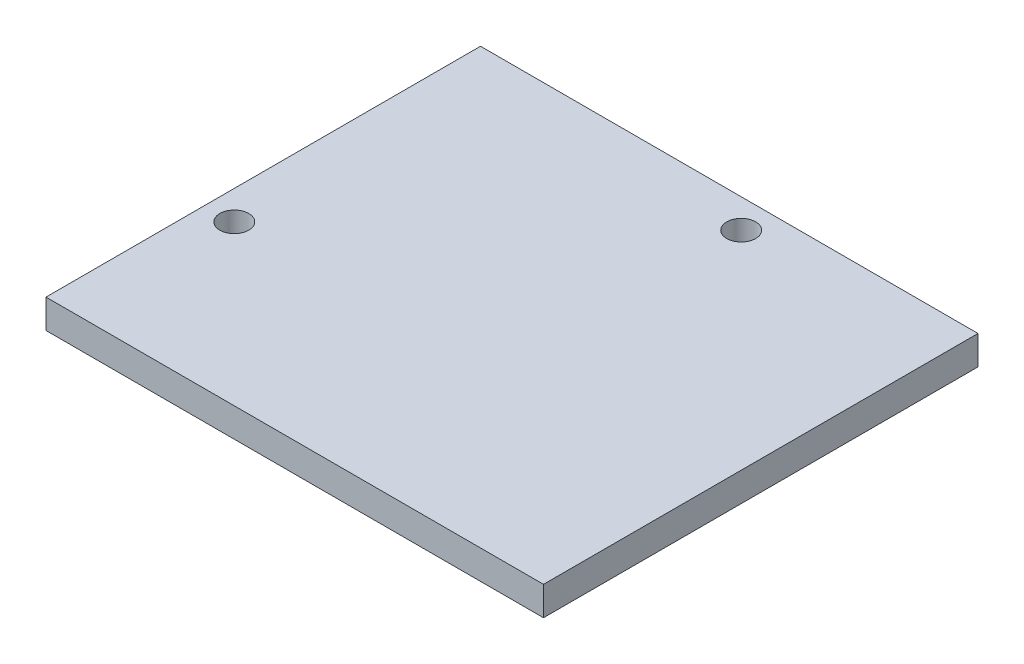
from build123d import *

# Parameters (mm, degrees)
SKETCH1_W           = 43.6245
SKETCH1_H           = 38.1
SKETCH1_R           = 1.27
BOSS_EXTRUDE1_DEPTH = 2.54


with BuildPart() as part:
    # Sketch1 → Boss-Extrude1 (new body)
    with BuildSketch(Plane(origin=(0, 0, 0), x_dir=(1, 0, 0), z_dir=(0, 1, 0))):
        with Locations((21.81225, -19.05)):
            Rectangle(SKETCH1_W, SKETCH1_H)
        with Locations((25.4, -2.54)):
            Circle(SKETCH1_R, mode=Mode.SUBTRACT)
        with Locations((2.54, -24.13)):
            Circle(SKETCH1_R, mode=Mode.SUBTRACT)
    extrude(amount=BOSS_EXTRUDE1_DEPTH)


solid = part.part
